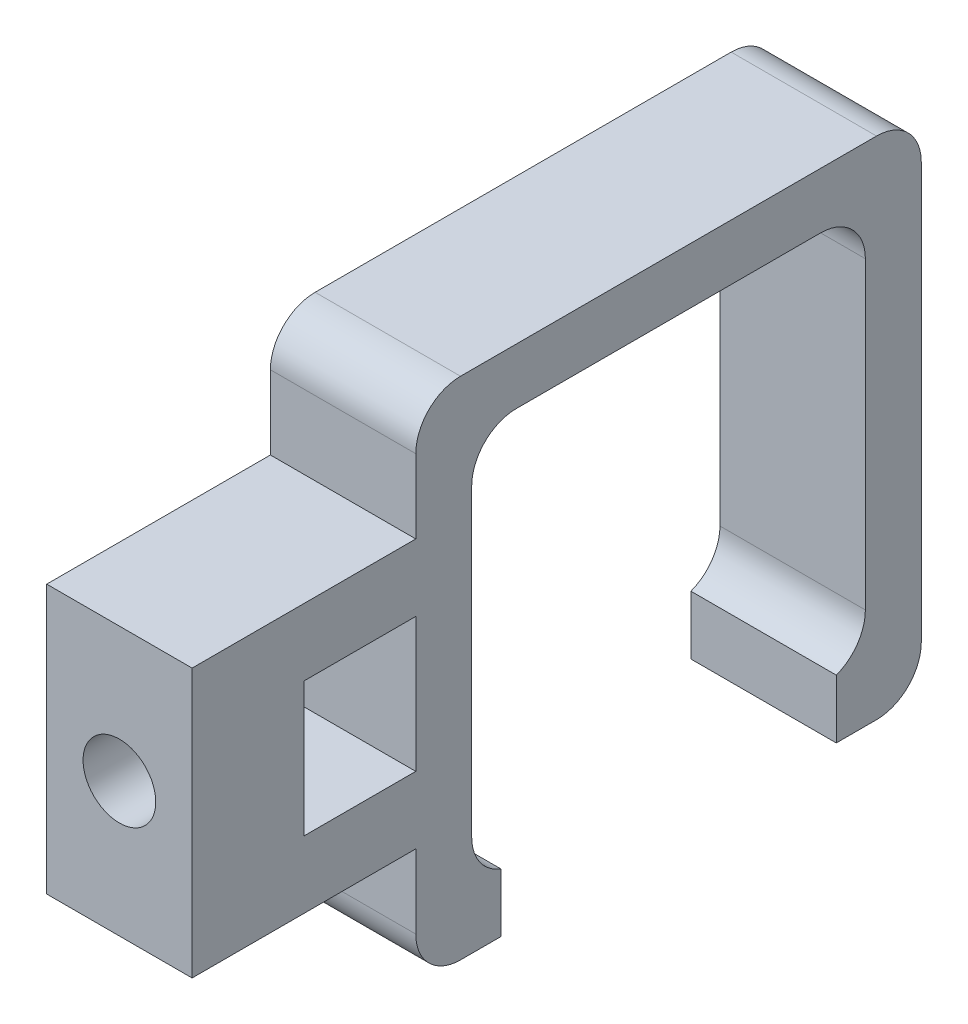
from build123d import *

# Parameters (mm, degrees)
SKETCH1_W           = 45.2
SKETCH1_H           = 45.2
SKETCH1_W_2         = 35.2
SKETCH1_H_2         = 35.2
BOSS_EXTRUDE1_DEPTH = 13
FILLET1_R           = 4
SKETCH3_W           = 30
SKETCH3_H           = 5.253001201
CUT_EXTRUDE1_DEPTH  = 35.503912822
SKETCH4_W           = 13
SKETCH4_H           = 6
BOSS_EXTRUDE2_DEPTH = 10
SKETCH5_W           = 13
SKETCH5_H           = 24
SKETCH5_R           = 3.25
BOSS_EXTRUDE3_DEPTH = 10


with BuildPart() as part:
    # Sketch1 → Boss-Extrude1 (new body)
    with BuildSketch(Plane(origin=(0, 0, 0), x_dir=(0, 0, -1), z_dir=(1, 0, 0))):
        Rectangle(SKETCH1_W, SKETCH1_H)
        Rectangle(SKETCH1_W_2, SKETCH1_H_2, mode=Mode.SUBTRACT)
    extrude(amount=-BOSS_EXTRUDE1_DEPTH)

    # Fillet1
    fillet1_edges = [part.edges().sort_by_distance(p)[0] for p in [
        (-6.5, -22.6, -22.6),
        (-6.5, -22.6, 22.6),
        (-6.5, 22.6, 22.6),
        (-6.5, 22.6, -22.6),
        (-6.5, -17.6, -17.6),
        (-6.5, 17.6, -17.6),
        (-6.5, -17.6, 17.6),
        (-6.5, 17.6, 17.6),
    ]]
    fillet(fillet1_edges, radius=FILLET1_R)

    # Sketch3 → Cut-Extrude1 (cut, through all)
    with BuildSketch(Plane(origin=(0, 0, 0), x_dir=(0, 0, -1), z_dir=(1, 0, 0))):
        with Locations((0, -19.973499399)):
            Rectangle(SKETCH3_W, SKETCH3_H)
    extrude(amount=-CUT_EXTRUDE1_DEPTH, mode=Mode.SUBTRACT)

    # Sketch4 → Boss-Extrude2 (add)
    with BuildSketch(Plane.XY.offset(22.6)):
        with Locations((-6.5, -9)):
            Rectangle(SKETCH4_W, SKETCH4_H)
        with Locations((-6.5, 9)):
            Rectangle(SKETCH4_W, SKETCH4_H)
    extrude(amount=BOSS_EXTRUDE2_DEPTH)

    # Sketch5 → Boss-Extrude3 (add)
    with BuildSketch(Plane.XY.offset(32.6)):
        with Locations((-6.5, 0)):
            Rectangle(SKETCH5_W, SKETCH5_H)
        with Locations((-6.5, 0)):
            Circle(SKETCH5_R, mode=Mode.SUBTRACT)
    extrude(amount=BOSS_EXTRUDE3_DEPTH)


solid = part.part
